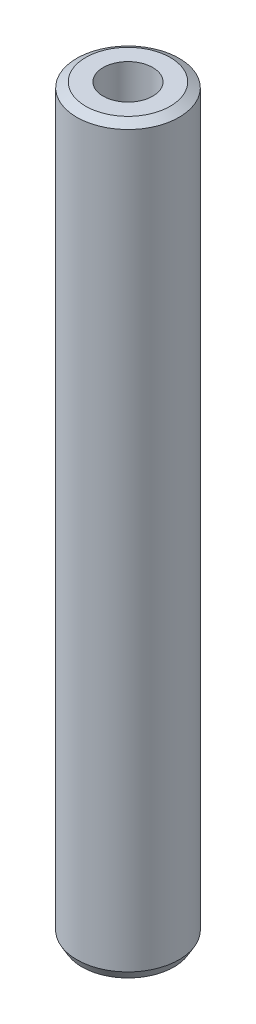
from build123d import *
from OCP.BRepFilletAPI import BRepFilletAPI_MakeChamfer

# Parameters (mm, degrees)
SKETCH1_R           = 5
BOSS_EXTRUDE1_DEPTH = 72.672429607
SKETCH2_R           = 2.426205788
CUT_EXTRUDE1_DEPTH  = 74.015628635
CHAMFER1_SIZE       = 0.501649334
CHAMFER1_SIZE2      = 0.868882133


with BuildPart() as part:
    # Sketch1 → Boss-Extrude1 (new body)
    with BuildSketch(Plane(origin=(0, 0, 0), x_dir=(1, 0, 0), z_dir=(0, 1, 0))):
        Circle(SKETCH1_R)
    extrude(amount=BOSS_EXTRUDE1_DEPTH)

    # Sketch2 → Cut-Extrude1 (cut, through all)
    with BuildSketch(Plane(origin=(0, 0, 0), x_dir=(1, 0, 0), z_dir=(0, 1, 0))):
        Circle(SKETCH2_R)
    extrude(amount=CUT_EXTRUDE1_DEPTH, mode=Mode.SUBTRACT)

    # Chamfer1: one chamfer whose edges measure the first distance from different faces: ONE call of the kernel's chamfer builder (chamfer() names one face for all edges)
    chamfer1_edges_1 = [part.edges().sort_by_distance(p)[0] for p in [
        (-5, 72.672429607, 0),
    ]]
    chamfer1_side_1 = [part.faces().sort_by_distance(p)[0] for p in [
        (-5, 36.336214803, 0),
    ]]
    chamfer1_edges_2 = [part.edges().sort_by_distance(p)[0] for p in [
        (-5, 0, 0),
    ]]
    chamfer1_side_2 = [part.faces().sort_by_distance(p)[0] for p in [
        (-4.858578644, 0, 0),
    ]]
    chamfer1 = BRepFilletAPI_MakeChamfer(part.part.solid().wrapped)
    for e in chamfer1_edges_1:
        chamfer1.Add(CHAMFER1_SIZE, CHAMFER1_SIZE2, e.wrapped, chamfer1_side_1[0].wrapped)  # the first distance lies on this face
    for e in chamfer1_edges_2:
        chamfer1.Add(CHAMFER1_SIZE, CHAMFER1_SIZE2, e.wrapped, chamfer1_side_2[0].wrapped)  # the first distance lies on this face
    add(Compound.cast(chamfer1.Shape()), mode=Mode.REPLACE)


solid = part.part
